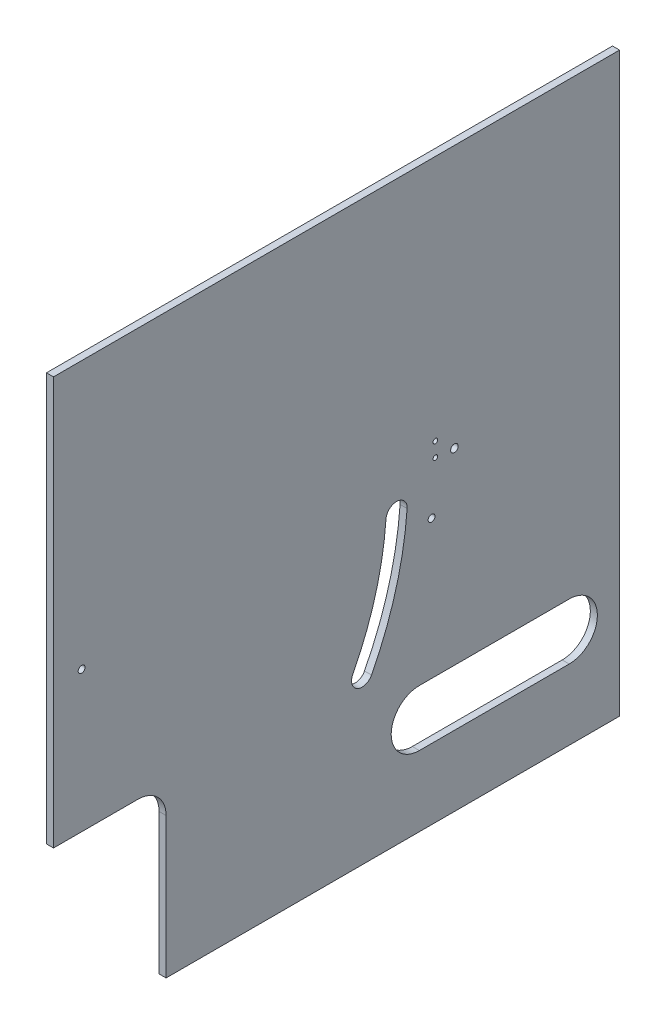
from build123d import *

# Parameters (mm, degrees)
SKETCH1_W           = 255.45
SKETCH1_H           = 260.35
BOSS_EXTRUDE1_DEPTH = 3.175
SKETCH2_W           = 255.45
SKETCH2_H           = 6.35
BOSS_EXTRUDE2_DEPTH = 12.7
CUT_EXTRUDE1_DEPTH  = 184.060705437
SKETCH5_W           = 54.590141408
SKETCH5_H           = 33.859166417
CUT_EXTRUDE2_DEPTH  = 288.144996039
SKETCH8_R           = 1.55
SKETCH8_R_2         = 1.6999966
SKETCH8_R_3         = 1.5499969
SKETCH8_R_4         = 1.05
CUT_EXTRUDE7_DEPTH  = 183.398703052
SKETCH9_W           = 50.8
SKETCH9_H           = 76.2
CUT_EXTRUDE8_DEPTH  = 183.398703052
FILLET1_R           = 12.7
CUT_EXTRUDE9_DEPTH  = 183.398703052


with BuildPart() as part:
    # Sketch1 → Boss-Extrude1 (new body)
    with BuildSketch(Plane(origin=(0, 0, 0), x_dir=(0, 0, -1), z_dir=(1, 0, 0))):
        Rectangle(SKETCH1_W, SKETCH1_H)
    extrude(amount=BOSS_EXTRUDE1_DEPTH)

    # Sketch2 → Boss-Extrude2 (add)
    with BuildSketch(Plane(origin=(3.175, 0, 0), x_dir=(0, 0, -1), z_dir=(1, 0, 0))):
        with Locations((0, 127)):
            Rectangle(SKETCH2_W, SKETCH2_H)
    extrude(amount=BOSS_EXTRUDE2_DEPTH)

    # Sketch3 → Cut-Extrude1 (cut, through all)
    with BuildSketch(Plane.ZY):
        with BuildLine():
            Line((-105.025, -73.025), (-37.375, -73.025))
            ThreePointArc((-37.375, -73.025), (-24.675, -85.725), (-37.375, -98.425))
            Line((-37.375, -98.425), (-105.025, -98.425))
            ThreePointArc((-105.025, -98.425), (-117.725, -85.725), (-105.025, -73.025))
        make_face()
    extrude(amount=-CUT_EXTRUDE1_DEPTH, mode=Mode.SUBTRACT)

    # Sketch5 → Cut-Extrude2 (cut, through all)
    with BuildSketch(Plane(origin=(0, 0, -127.725), x_dir=(-1, 0, 0), z_dir=(0, 0, -1))):
        with Locations((-30.470070704, 140.754583209)):
            Rectangle(SKETCH5_W, SKETCH5_H)
    extrude(amount=-CUT_EXTRUDE2_DEPTH, mode=Mode.SUBTRACT)

    # Sketch8 → Cut-Extrude7 (cut, through all)
    with BuildSketch(Plane.ZY):
        with Locations((115.025, 9.525)):
            Circle(SKETCH8_R)
        with Locations((-53.205, 11.825)):
            Circle(SKETCH8_R_2)
        with Locations((-42.9049952, -10.375)):
            Circle(SKETCH8_R_3)
        with Locations((-44.605, 18.925)):
            Circle(SKETCH8_R_4)
        with Locations((-44.605, 12.425)):
            Circle(SKETCH8_R_4)
    extrude(amount=-CUT_EXTRUDE7_DEPTH, mode=Mode.SUBTRACT)

    # Sketch9 → Cut-Extrude8 (cut, through all)
    with BuildSketch(Plane.ZY):
        with Locations((102.325, -92.075)):
            Rectangle(SKETCH9_W, SKETCH9_H)
    extrude(amount=-CUT_EXTRUDE8_DEPTH, mode=Mode.SUBTRACT)

    # Fillet1
    fillet1_edges = [part.edges().sort_by_distance(p)[0] for p in [
        (1.5875, -53.975, 76.925),
    ]]
    fillet(fillet1_edges, radius=FILLET1_R)

    # Sketch10 → Cut-Extrude9 (cut, through all)
    with BuildSketch(Plane.ZY):
        with BuildLine():
            ThreePointArc((-15.792035743, -58.127079483), (-9.357313119, -60.175), (-7.309392602, -53.740277376))
            ThreePointArc((-7.309392602, -53.740277376), (-17.536268555, -27.834189149), (-22.341982218, -0.400277376))
            ThreePointArc((-22.341982218, -0.400277376), (-27.448590626, 4.018114216), (-31.866982218, -1.088494191))
            ThreePointArc((-31.866982218, -1.088494191), (-26.728041298, -30.424668105), (-15.792035743, -58.127079483))
        make_face()
    extrude(amount=-CUT_EXTRUDE9_DEPTH, mode=Mode.SUBTRACT)


solid = part.part
